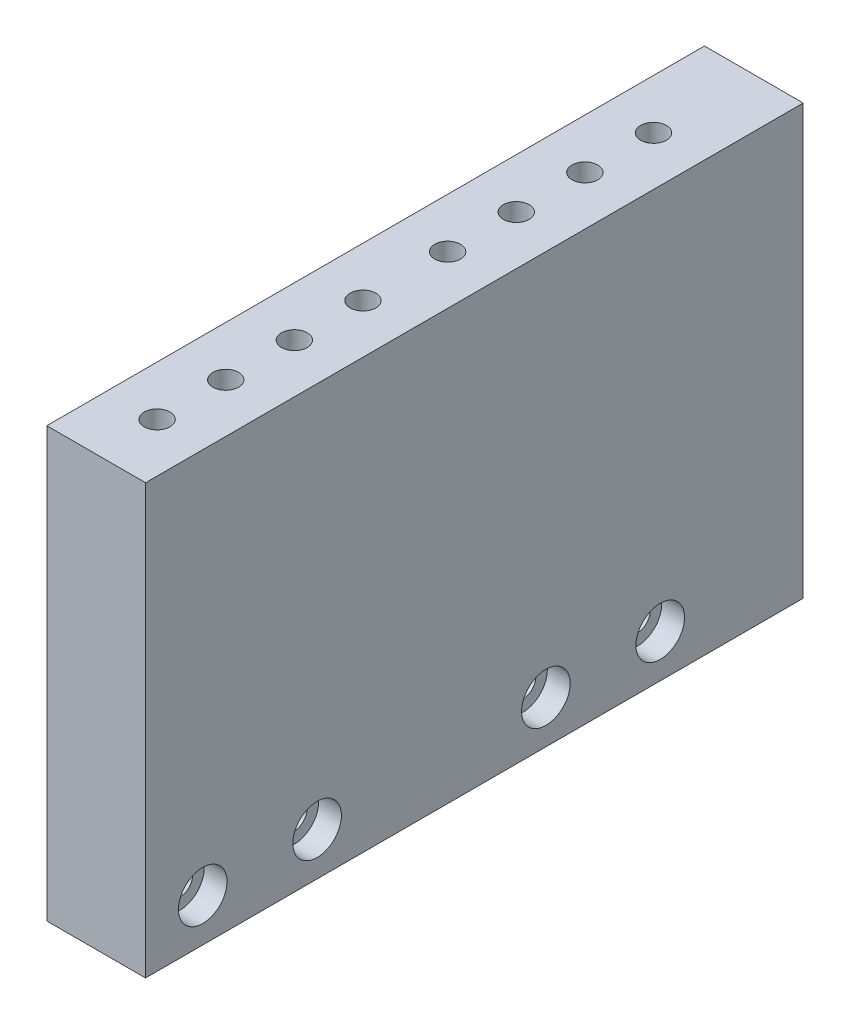
from build123d import *
from OCP.BRepFilletAPI import BRepFilletAPI_MakeChamfer

# Parameters (mm, degrees)
SKETCH1_W                               = 115
SKETCH1_H                               = 75
BOSS_EXTRUDE1_DEPTH                     = 17.272
M4_CLEARANCE_HOLE1_AT_2_COUNT           = 2
M4_CLEARANCE_HOLE1_AT_2_PITCH           = 50.8
SKETCH5_W                               = 10.5
SKETCH5_H                               = 5
CUT_EXTRUDE1_DEPTH                      = 14.08
LPATTERN1_COUNT                         = 2
LPATTERN1_PITCH                         = 12
LPATTERN1_COL_COUNT                     = 3
LPATTERN1_COL_PITCH                     = 12
CBORE_FOR_M5_HEX_HEAD_BOLT1_D           = 4.5
CBORE_FOR_M5_HEX_HEAD_BOLT1_CBORE_D     = 8.5
CBORE_FOR_M5_HEX_HEAD_BOLT1_CBORE_DEPTH = 4
BOSS_EXTRUDE3_DEPTH                     = 17.228
CHAMFER2_SIZE                           = 17.228
CHAMFER2_SIZE_2                         = 38.6
M4_CLEARANCE_HOLE3_D                    = 4.5


with BuildPart() as part:
    # Sketch1 → Boss-Extrude1 (new body)
    with BuildSketch(Plane(origin=(0, 0, 0), x_dir=(0, 0, -1), z_dir=(1, 0, 0))):
        Rectangle(SKETCH1_W, SKETCH1_H)
    extrude(amount=BOSS_EXTRUDE1_DEPTH)

    # Sketch4 → M4 Clearance Hole1 (revolve, cut)
    with BuildSketch(Plane(origin=(8.692, 37.5, 22.9), x_dir=(0, 0, 1), z_dir=(1, 0, 0))):
        Polygon((0, 0), (0, 7.351936393), (2.25, 6), (2.25, 0), align=None)
    m4_clearance_hole1 = revolve(axis=Axis((8.692, 43.85, 22.9), (0, -1, 0)), mode=Mode.SUBTRACT)

    # M4 Clearance Hole1 at 2: M4 Clearance Hole1 ×2
    with Locations(*[(0, 0, -i * M4_CLEARANCE_HOLE1_AT_2_PITCH) for i in range(1, M4_CLEARANCE_HOLE1_AT_2_COUNT)]):
        add(m4_clearance_hole1, mode=Mode.SUBTRACT)

    # Sketch5 → Cut-Extrude1 (cut)
    with BuildSketch(Plane.ZY):
        with Locations((-27.9, 29)):
            Rectangle(SKETCH5_W, SKETCH5_H)
        with Locations((22.9, 29)):
            Rectangle(SKETCH5_W, SKETCH5_H)
    cut_extrude1 = extrude(amount=-CUT_EXTRUDE1_DEPTH, mode=Mode.SUBTRACT)

    # LPattern1: M4 Clearance Hole1, Cut-Extrude1 ×2
    with Locations(*[(0, 0, -i * LPATTERN1_PITCH) for i in range(1, LPATTERN1_COUNT)]):
        add(m4_clearance_hole1, mode=Mode.SUBTRACT)
        add(cut_extrude1, mode=Mode.SUBTRACT)

    # LPattern1 copy 1 sketch → LPattern1 copy 1 (revolve, cut)
    with BuildSketch(Plane(origin=(8.692, 37.5, -39.9), x_dir=(0, 0, 1), z_dir=(1, 0, 0))):
        Polygon((0, 0), (0, 7.351936393), (2.25, 6), (2.25, 0), align=None)
    revolve(axis=Axis((8.692, 43.85, -39.9), (0, -1, 0)), mode=Mode.SUBTRACT)

    # LPattern1 col: M4 Clearance Hole1, Cut-Extrude1 ×3
    with Locations(*[(0, 0, i * LPATTERN1_COL_PITCH) for i in range(1, LPATTERN1_COL_COUNT)]):
        add(m4_clearance_hole1, mode=Mode.SUBTRACT)
        add(cut_extrude1, mode=Mode.SUBTRACT)

    # LPattern1 col copy 1 sketch → LPattern1 col copy 1 (revolve, cut)
    with BuildSketch(Plane(origin=(8.692, 37.5, -15.9), x_dir=(0, 0, 1), z_dir=(1, 0, 0))):
        Polygon((0, 0), (0, 7.351936393), (2.25, 6), (2.25, 0), align=None)
    revolve(axis=Axis((8.692, 43.85, -15.9), (0, -1, 0)), mode=Mode.SUBTRACT)

    # LPattern1 col copy 2 sketch → LPattern1 col copy 2 (revolve, cut)
    with BuildSketch(Plane(origin=(8.692, 37.5, -3.9), x_dir=(0, 0, 1), z_dir=(1, 0, 0))):
        Polygon((0, 0), (0, 7.351936393), (2.25, 6), (2.25, 0), align=None)
    revolve(axis=Axis((8.692, 43.85, -3.9), (0, -1, 0)), mode=Mode.SUBTRACT)

    # CBORE for M5 Hex Head Bolt1 (through all)
    with Locations(Plane(origin=(17.272, 0, 0), x_dir=(0, 0, -1), z_dir=(1, 0, 0))):
        with Locations((32.5, -30), (12.5, -30), (-27.5, -30), (-47.5, -30)):
            CounterBoreHole(CBORE_FOR_M5_HEX_HEAD_BOLT1_D / 2, CBORE_FOR_M5_HEX_HEAD_BOLT1_CBORE_D / 2, CBORE_FOR_M5_HEX_HEAD_BOLT1_CBORE_DEPTH)

    # Sketch12 → Boss-Extrude3 (add)
    with BuildSketch(Plane.ZY):
        Polygon((-12.5, 21.5), (-12.5, -22.1), (27.5, -22.1), (27.5, 21.5), (17.5, 21.5), (17.5, -17.1), (-2.5, -17.1), (-2.5, 21.5), align=None)
    extrude(amount=BOSS_EXTRUDE3_DEPTH)

    # Chamfer2
    chamfer2_edges_1 = [part.edges().sort_by_distance(p)[0] for p in [
        (-17.228, 21.5, -7.5),
    ]]
    chamfer2_side_1 = [part.faces().sort_by_distance(p)[0] for p in [
        (-16.88344, 21.5, -7.5),
    ]]
    chamfer2_edges_2 = [part.edges().sort_by_distance(p)[0] for p in [
        (-17.228, 21.5, 22.5),
    ]]
    chamfer2_side_2 = [part.faces().sort_by_distance(p)[0] for p in [
        (-16.88344, 21.5, 22.5),
    ]]
    chamfer2 = BRepFilletAPI_MakeChamfer(part.part.solid().wrapped)
    for e in chamfer2_edges_1:
        chamfer2.Add(CHAMFER2_SIZE - 0.0001, CHAMFER2_SIZE_2 - 0.0001, e.wrapped, chamfer2_side_1[0].wrapped)
    for e in chamfer2_edges_2:
        chamfer2.Add(CHAMFER2_SIZE - 0.0001, CHAMFER2_SIZE_2 - 0.0001, e.wrapped, chamfer2_side_2[0].wrapped)
    add(Compound.cast(chamfer2.Shape()), mode=Mode.REPLACE)  # a hair under: the kernel refuses the full size

    # M4 Clearance Hole3 (through all)
    with Locations(Plane(origin=(0, -17.1, 0), x_dir=(1, 0, 0), z_dir=(0, 1, 0))):
        with Locations((-8.614, -7.5)):
            Hole(M4_CLEARANCE_HOLE3_D / 2)


solid = part.part
